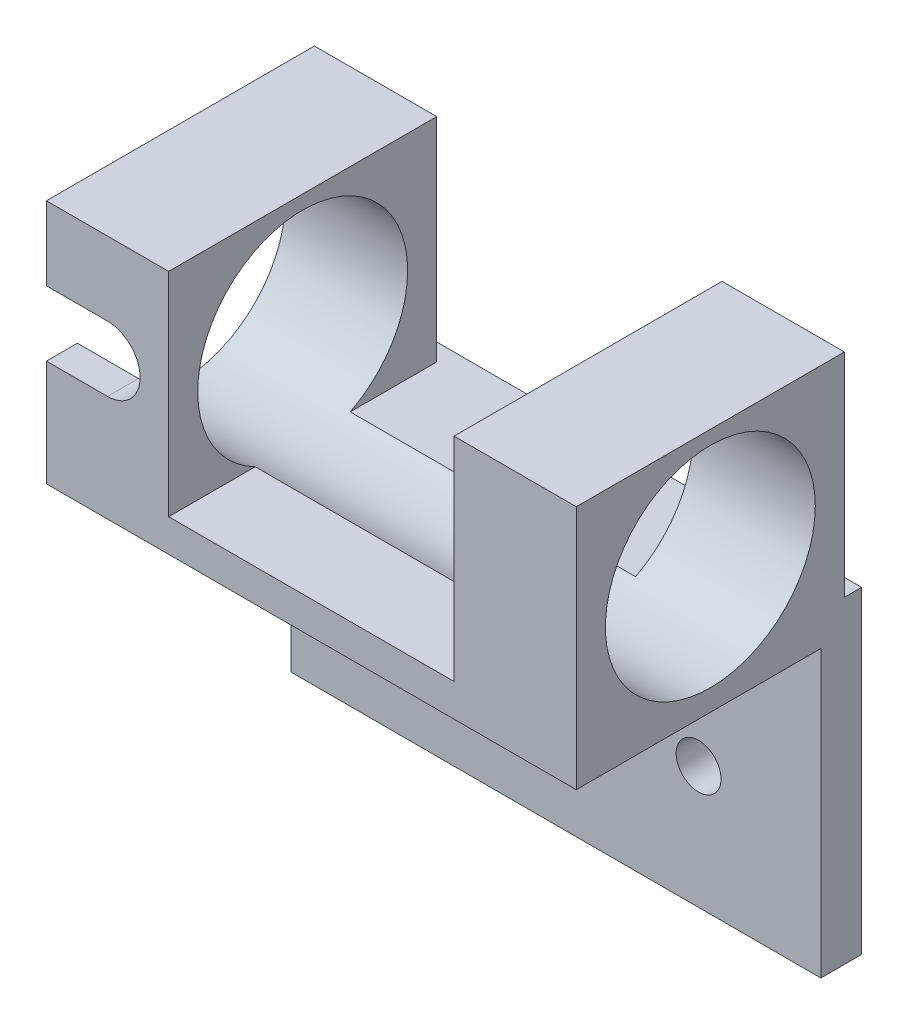
from build123d import *

# Parameters (mm, degrees)
CROQUIS2_W              = 65
CROQUIS2_H              = 35
CROQUIS2_R              = 2.75
SALIENTE_EXTRUIR1_DEPTH = 5
CROQUIS3_W              = 65
CROQUIS3_H              = 35
SALIENTE_EXTRUIR2_DEPTH = 4
SALIENTE_EXTRUIR3_DEPTH = 15
SALIENTE_EXTRUIR4_START = -65
SALIENTE_EXTRUIR4_DEPTH = 15
CORTAR_EXTRUIR1_DEPTH   = 85.965620518
CORTAR_EXTRUIR2_START   = -32.882450487
CORTAR_EXTRUIR2_DEPTH   = 4.823037372


# Read off the part's stored shape, not the designer's step: Cortar-Extruir2
with BuildPart() as part:
    # Croquis2 → Saliente-Extruir1 (new body)
    with BuildSketch(Plane.XY):
        with Locations((0, -5.5)):
            Rectangle(CROQUIS2_W, CROQUIS2_H)
        with Locations((17.5, -8)):
            Circle(CROQUIS2_R, mode=Mode.SUBTRACT)
        with Locations((-17.5, -8)):
            Circle(CROQUIS2_R, mode=Mode.SUBTRACT)
    extrude(amount=SALIENTE_EXTRUIR1_DEPTH)

    # Croquis3 → Saliente-Extruir2 (add)
    with BuildSketch(Plane(origin=(0, 12, 0), x_dir=(1, 0, 0), z_dir=(0, 1, 0))):
        with Locations((0, -17.5)):
            Rectangle(CROQUIS3_W, CROQUIS3_H)
    extrude(amount=SALIENTE_EXTRUIR2_DEPTH)

    # Croquis4 → Saliente-Extruir3 (add)
    with BuildSketch(Plane(origin=(32.5, 0, 0), x_dir=(0, 0, -1), z_dir=(1, 0, 0))):
        with BuildLine():
            Line((-35, 42.06134413), (-35, 16))
            Line((-35, 16), (-24.382874813, 16))
            ThreePointArc((-24.382874813, 16), (-25.295997358, 38.453973796), (-5.683774756, 27.482398858))
            ThreePointArc((-5.683774756, 27.482398858), (-7.587199819, 20.745176256), (-12.7346747, 16))
            Line((-12.7346747, 16), (-2.117549513, 16))
            Line((-2.117549513, 16), (-2.117549513, 42.06134413))
            Line((-2.117549513, 42.06134413), (-35, 42.06134413))
        make_face()
        with BuildLine():
            Line((-12.7346747, 16), (-24.382874813, 16))
            ThreePointArc((-24.382874813, 16), (-18.558774756, 14.607398858), (-12.7346747, 16))
        make_face()
        with BuildLine():
            ThreePointArc((-5.683774756, 27.482398858), (-25.295997358, 38.453973796), (-24.382874813, 16))
            Line((-24.382874813, 16), (-12.7346747, 16))
            ThreePointArc((-12.7346747, 16), (-7.587199819, 20.745176256), (-5.683774756, 27.482398858))
        make_face()
    extrude(amount=-SALIENTE_EXTRUIR3_DEPTH)

    # Croquis4<6> → Saliente-Extruir4 (add)
    with BuildSketch(Plane(origin=(32.5, 0, 0), x_dir=(0, 0, -1), z_dir=(1, 0, 0)).offset(SALIENTE_EXTRUIR4_START)):
        with BuildLine():
            Line((-35, 42.06134413), (-35, 16))
            Line((-35, 16), (-24.382874813, 16))
            ThreePointArc((-24.382874813, 16), (-25.295997358, 38.453973796), (-5.683774756, 27.482398858))
            ThreePointArc((-5.683774756, 27.482398858), (-7.587199819, 20.745176256), (-12.7346747, 16))
            Line((-12.7346747, 16), (-2.117549513, 16))
            Line((-2.117549513, 16), (-2.117549513, 42.06134413))
            Line((-2.117549513, 42.06134413), (-35, 42.06134413))
        make_face()
        with BuildLine():
            Line((-12.7346747, 16), (-24.382874813, 16))
            ThreePointArc((-24.382874813, 16), (-18.558774756, 14.607398858), (-12.7346747, 16))
        make_face()
        with BuildLine():
            ThreePointArc((-5.683774756, 27.482398858), (-25.295997358, 38.453973796), (-24.382874813, 16))
            Line((-24.382874813, 16), (-12.7346747, 16))
            ThreePointArc((-12.7346747, 16), (-7.587199819, 20.745176256), (-5.683774756, 27.482398858))
        make_face()
    extrude(amount=SALIENTE_EXTRUIR4_DEPTH)

    # Croquis4<4> → Cortar-Extruir1 (cut, through all)
    with BuildSketch(Plane(origin=(32.5, 0, 0), x_dir=(0, 0, -1), z_dir=(1, 0, 0))):
        with BuildLine():
            Line((-12.7346747, 16), (-24.382874813, 16))
            ThreePointArc((-24.382874813, 16), (-18.558774756, 14.607398858), (-12.7346747, 16))
        make_face()
        with BuildLine():
            ThreePointArc((-5.683774756, 27.482398858), (-25.295997358, 38.453973796), (-24.382874813, 16))
            Line((-24.382874813, 16), (-12.7346747, 16))
            ThreePointArc((-12.7346747, 16), (-7.587199819, 20.745176256), (-5.683774756, 27.482398858))
        make_face()
    extrude(amount=-CORTAR_EXTRUIR1_DEPTH, mode=Mode.SUBTRACT)

    # Cortar-Extruir2 outline → Cortar-Extruir2 (cut)
    with BuildSketch(Plane(origin=(0, 0, 2.117549513), x_dir=(-1, 0, 0), z_dir=(0, 0, -1)).offset(CORTAR_EXTRUIR2_START)):
        with BuildLine():
            Line((32.5, 33.030672065), (25, 33.030672065))
            ThreePointArc((25, 33.030672065), (21, 29.030672065), (25, 25.030672065))
            Line((25, 25.030672065), (32.5, 25.030672065))
            Line((32.5, 25.030672065), (32.5, 33.030672065))
        make_face()
    extrude(amount=CORTAR_EXTRUIR2_DEPTH, mode=Mode.SUBTRACT)


solid = part.part
